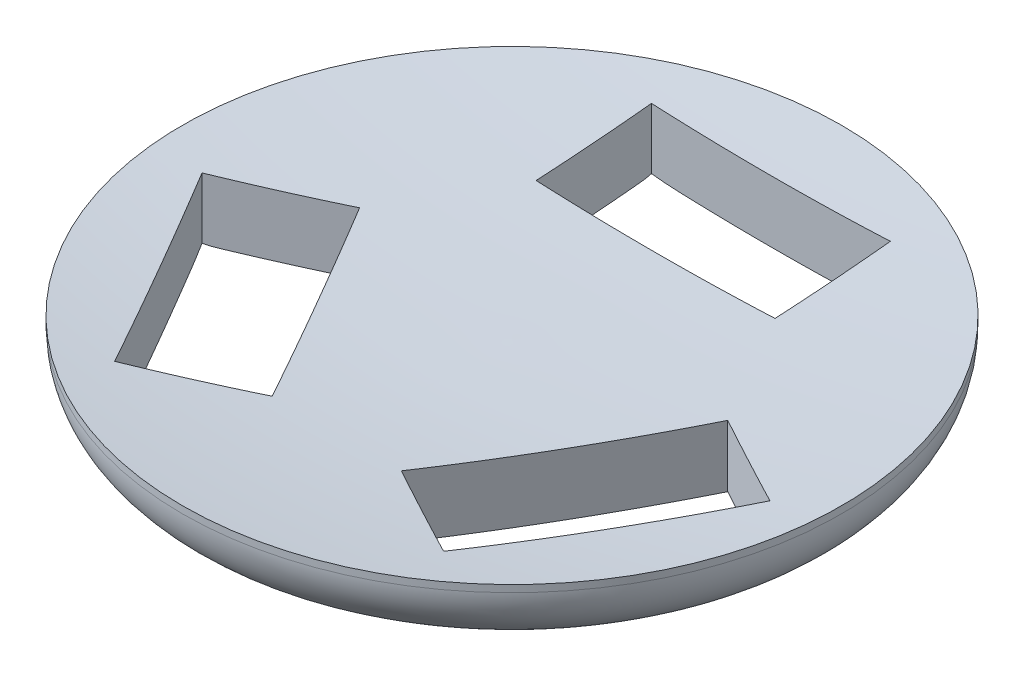
from build123d import *

# Parameters (mm, degrees)
SKETCH2_W          = 58
SKETCH2_H          = 28
CUT_EXTRUDE1_DEPTH = 40


with BuildPart() as part:
    # Sketch3 → Revolve1 (revolve)
    with BuildSketch(Plane(origin=(0, 0, 0), x_dir=(0, 0, -1), z_dir=(1, 0, 0))):
        with BuildLine():
            Line((80, 18.293202552), (80, 20))
            ThreePointArc((80, 20), (40.087178597, 16.105142444), (0, 15))
            Line((0, 15), (0, 0))
            ThreePointArc((0, 0), (33.362860798, 0.724370017), (66.627608361, 3.381767644))
            ThreePointArc((66.627608361, 3.381767644), (76.167231649, 8.278566398), (80, 18.293202552))
        make_face()
    revolve(axis=Axis((0, 15, 0), (0, -1, 0)))

    # Sketch2 → Cut-Extrude1 (cut)
    with BuildSketch(Plane(origin=(0, 0, 0), x_dir=(1, 0, 0), z_dir=(0, 1, 0))):
        with Locations((0, 48.851669886)):
            Rectangle(SKETCH2_W, SKETCH2_H)
        Polygon((68.931142791, -6.311098233), (39.931142791, -56.540571653), (15.682431485, -42.540571653), (44.682431485, 7.688901767), align=None)
        Polygon((-39.931142791, -56.540571653), (-68.931142791, -6.311098233), (-44.682431485, 7.688901767), (-15.682431485, -42.540571653), align=None)
    extrude(amount=CUT_EXTRUDE1_DEPTH, mode=Mode.SUBTRACT)


solid = part.part
